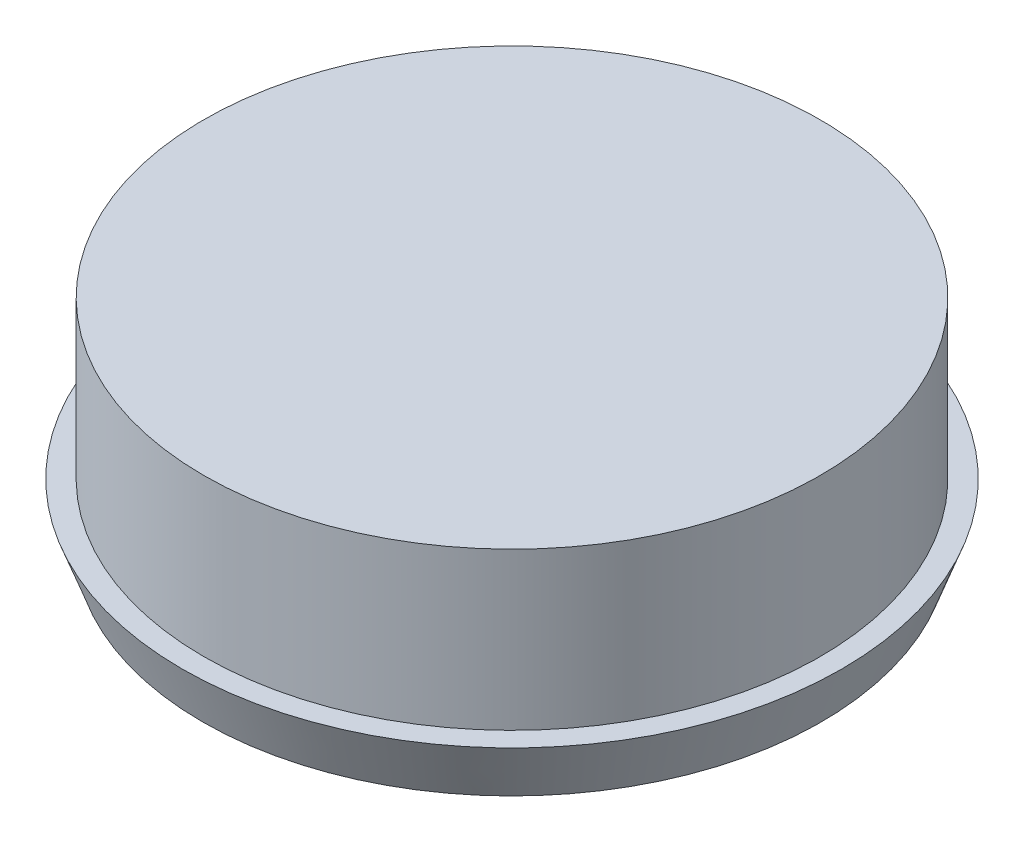
from build123d import *

# Parameters (mm, degrees)
SKETCH1_R           = 29.5
BOSS_EXTRUDE1_DEPTH = 5
SKETCH2_R           = 27.5
BOSS_EXTRUDE2_DEPTH = 14
CHAMFER1_SIZE       = 5.220207097
CHAMFER1_SIZE_2     = 1.9
SKETCH3_R           = 1.5
CUT_EXTRUDE1_DEPTH  = 3.5
SKETCH4_R           = 3
BOSS_EXTRUDE3_DEPTH = 2.7
CHAMFER2_SIZE       = 0.2


with BuildPart() as part:
    # Sketch1 → Boss-Extrude1 (new body)
    with BuildSketch(Plane(origin=(0, 0, 0), x_dir=(1, 0, 0), z_dir=(0, 1, 0))):
        with Locations(Location((0, 0, 0), (0, 0, 270))):
            Circle(SKETCH1_R)
    extrude(amount=BOSS_EXTRUDE1_DEPTH)

    # Sketch2 → Boss-Extrude2 (add)
    with BuildSketch(Plane(origin=(0, 5, 0), x_dir=(1, 0, 0), z_dir=(0, 1, 0))):
        with Locations(Location((0, 0, 0), (0, 0, 270))):
            Circle(SKETCH2_R)
    extrude(amount=BOSS_EXTRUDE2_DEPTH)

    # Chamfer1
    # the kernel refuses this chamfer: 5.220207097, 1.9 mm, written as the material it takes off along each edge
    with BuildSketch(Plane(origin=(0, 0, 0), x_dir=(0, 0, 1), z_dir=(-1, 0, 0))) as chamfer1_piece_1:
        Polygon((29.5, CHAMFER1_SIZE), (29.5 - CHAMFER1_SIZE_2, 0), (29.5, 0), align=None)
    revolve(axis=Axis((0, 0, 0), (0, 1, 0)), mode=Mode.SUBTRACT)

    # Sketch3 → Cut-Extrude1 (cut)
    with BuildSketch(Plane.XZ):
        with Locations(Location((0, 12.5, 0), (0, 0, 270))):
            Circle(SKETCH3_R)
        with Locations(Location((12.5, 0, 0), (0, 0, 270))):
            Circle(SKETCH3_R)
        with Locations(Location((0, -12.5, 0), (0, 0, 270))):
            Circle(SKETCH3_R)
        with Locations(Location((-12.5, 0, 0), (0, 0, 270))):
            Circle(SKETCH3_R)
    extrude(amount=-CUT_EXTRUDE1_DEPTH, mode=Mode.SUBTRACT)

    # Sketch4 → Boss-Extrude3 (add)
    with BuildSketch(Plane.XZ):
        with Locations(Location((0, 0, 0), (0, 0, 90))):
            Circle(SKETCH4_R)
    extrude(amount=BOSS_EXTRUDE3_DEPTH)

    # Chamfer2
    chamfer2_edges = [part.edges().sort_by_distance(p)[0] for p in [
        (0, -2.7, -3),
    ]]
    chamfer(chamfer2_edges, length=CHAMFER2_SIZE)


solid = part.part
